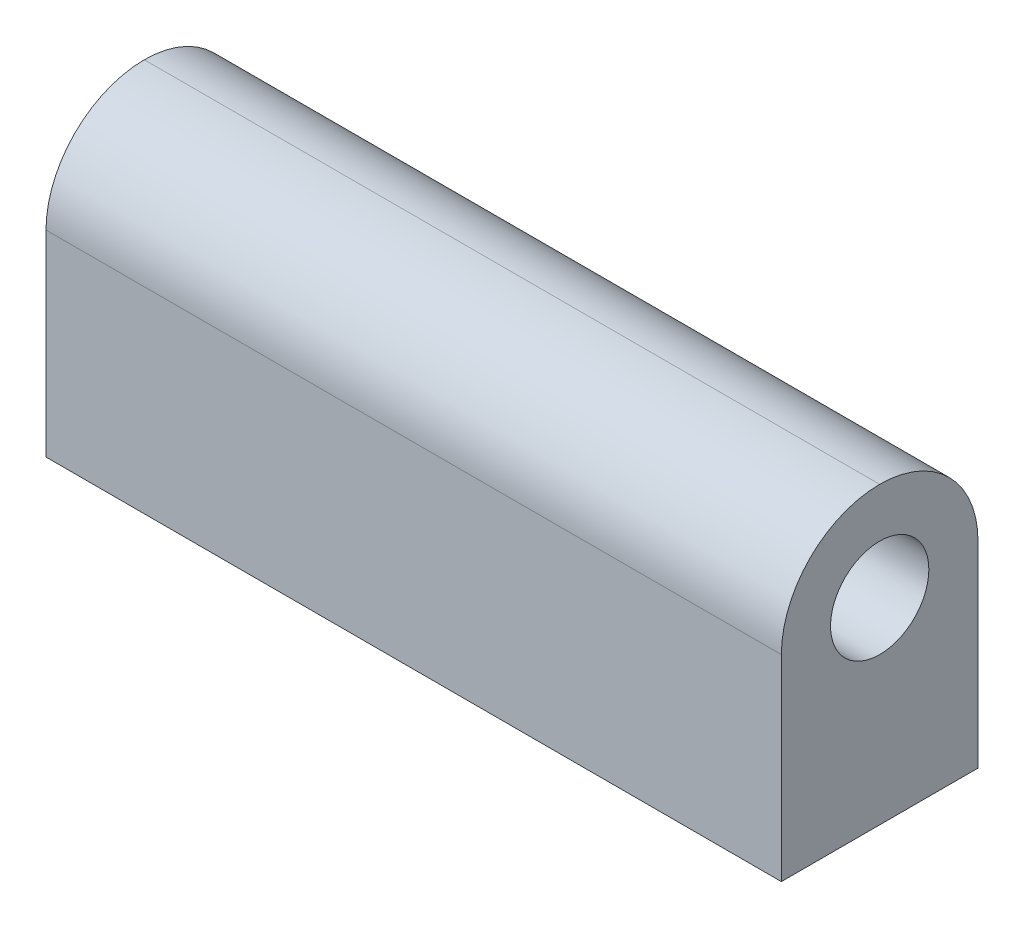
from build123d import *

# Parameters (mm, degrees)
SKETCH1_W                 = 37.4
SKETCH1_H                 = 10
BOSS_EXTRUDE1_DEPTH       = 15
FILLET1_R                 = 5
F_1_0MM_DOWEL_HOLE1_D     = 5
F_1_0MM_DOWEL_HOLE1_DEPTH = 4.2
F_1_0MM_DOWEL_HOLE1_TIP   = 1.502151548


with BuildPart() as part:
    # Sketch1 → Boss-Extrude1 (new body)
    with BuildSketch(Plane(origin=(0, 0, 0), x_dir=(1, 0, 0), z_dir=(0, 1, 0))):
        Rectangle(SKETCH1_W, SKETCH1_H)
    extrude(amount=BOSS_EXTRUDE1_DEPTH)

    # Fillet1
    fillet1_edges = [part.edges().sort_by_distance(p)[0] for p in [
        (0, 15, -5),
        (0, 15, 5),
    ]]
    fillet(fillet1_edges, radius=FILLET1_R - 0.0001)  # a hair under: the kernel refuses the full size

    # Sketch11 → CBORE for M5 Hex Head Bolt2 (revolve, cut)
    with BuildSketch(Plane(origin=(-18.7, 10, 0), x_dir=(0, 0, 1), z_dir=(0, 1, 0))):
        Polygon((0, 0), (0, 11.351936393), (2.25, 10), (2.25, 8), (2.5, 8), (2.5, 0), align=None)
    cbore_for_m5_hex_head_bolt2 = revolve(axis=Axis((-25.05, 10, 0), (1, 0, 0)), mode=Mode.SUBTRACT)

    # Mirror1: CBORE for M5 Hex Head Bolt2 across plane
    add(cbore_for_m5_hex_head_bolt2.mirror(Plane(origin=(0, 0, 0), x_dir=(0, 0, 1), z_dir=(1, 0, 0))), mode=Mode.SUBTRACT)

    # Ø1.0mm Dowel Hole1
    with Locations(Plane(origin=(0, 0, 0), x_dir=(-1, 0, 0), z_dir=(0, -1, 0))):
        with Locations((-5, 0), (5, 0)):
            Hole(F_1_0MM_DOWEL_HOLE1_D / 2, depth=F_1_0MM_DOWEL_HOLE1_DEPTH)
            with Locations((0, 0, -(F_1_0MM_DOWEL_HOLE1_DEPTH + F_1_0MM_DOWEL_HOLE1_TIP / 2))):  # 118° drill point
                Cone(0, F_1_0MM_DOWEL_HOLE1_D / 2, F_1_0MM_DOWEL_HOLE1_TIP, mode=Mode.SUBTRACT)


solid = part.part
